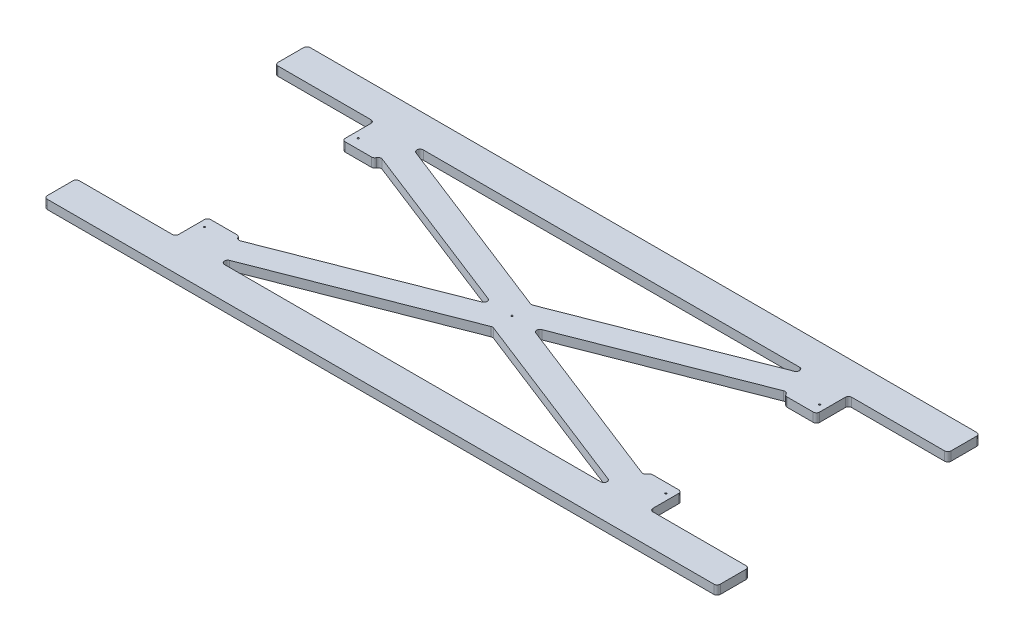
from build123d import *

# Parameters (mm, degrees)
SKETCH1_W                    = 1333.5
SKETCH1_H                    = 520.7
BOSS_EXTRUDE1_DEPTH          = 17.78
FILLET1_R                    = 6.35
F_1_8_0_125_DIAMETER_HOLE1_D = 3.175
SKETCH5_W                    = 152.4
SKETCH5_H                    = 393.7
CUT_EXTRUDE1_DEPTH           = 716.998473043
FILLET2_R                    = 6.35
SKETCH6_W                    = 50.8
SKETCH6_H                    = 393.7
SKETCH6_W_2                  = 63.5
SKETCH6_H_2                  = 266.7
CUT_EXTRUDE2_DEPTH           = 716.998473043
FILLET3_R                    = 6.35


with BuildPart() as part:
    # Sketch1 → Boss-Extrude1 (new body)
    with BuildSketch(Plane(origin=(0, 0, 0), x_dir=(1, 0, 0), z_dir=(0, 1, 0))):
        Rectangle(SKETCH1_W, SKETCH1_H)
    extrude(amount=BOSS_EXTRUDE1_DEPTH)

    # Fillet1
    fillet1_edges = [part.edges().sort_by_distance(p)[0] for p in [
        (-666.75, 8.89, 260.35),
        (-666.75, 8.89, -260.35),
        (666.75, 8.89, -260.35),
        (666.75, 8.89, 260.35),
    ]]
    fillet(fillet1_edges, radius=FILLET1_R)

    # 1/8 (0.125) Diameter Hole1 (through all)
    with Locations(Plane(origin=(0, 17.78, 0), x_dir=(1, 0, 0), z_dir=(0, 1, 0))):
        with Locations((0, 0), (457.2, 152.4), (-457.2, -152.4), (-457.2, 152.4), (457.2, -152.4)):
            Hole(F_1_8_0_125_DIAMETER_HOLE1_D / 2)

    # Sketch5 → Cut-Extrude1 (cut, through all)
    with BuildSketch(Plane(origin=(0, 17.78, 0), x_dir=(1, 0, 0), z_dir=(0, 1, 0))):
        Polygon((-406.4, 196.85), (406.4, 196.85), (0, 38.1), align=None)
        Polygon((0, -38.1), (-406.4, -196.85), (406.4, -196.85), align=None)
        Polygon((406.4, 143.8671875), (406.4, -143.8671875), (38.1, 0), align=None)
        Polygon((-406.4, 143.8671875), (-38.1, 0), (-406.4, -143.8671875), align=None)
        with Locations((546.1, 0)):
            Rectangle(SKETCH5_W, SKETCH5_H)
        with Locations((-546.1, 0)):
            Rectangle(SKETCH5_W, SKETCH5_H)
    extrude(amount=-CUT_EXTRUDE1_DEPTH, mode=Mode.SUBTRACT)

    # Fillet2
    fillet2_edges = [part.edges().sort_by_distance(p)[0] for p in [
        (469.9, 8.89, -196.85),
        (469.9, 8.89, 196.85),
        (622.3, 8.89, 196.85),
        (406.4, 8.89, 143.8671875),
        (406.4, 8.89, 196.85),
        (622.3, 8.89, -196.85),
        (406.4, 8.89, -143.8671875),
        (406.4, 8.89, -196.85),
        (38.1, 8.89, 0),
        (0, 8.89, 38.1),
        (0, 8.89, -38.1),
        (-38.1, 8.89, 0),
        (-406.4, 8.89, 196.85),
        (-406.4, 8.89, -196.85),
        (-406.4, 8.89, -143.8671875),
        (-406.4, 8.89, 143.8671875),
        (-622.3, 8.89, 196.85),
        (-469.9, 8.89, 196.85),
        (-469.9, 8.89, -196.85),
        (-622.3, 8.89, -196.85),
    ]]
    fillet(fillet2_edges, radius=FILLET2_R)

    # Sketch6 → Cut-Extrude2 (cut, through all)
    with BuildSketch(Plane(origin=(0, 17.78, 0), x_dir=(1, 0, 0), z_dir=(0, 1, 0))):
        with Locations((641.35, 0)):
            Rectangle(SKETCH6_W, SKETCH6_H)
        with Locations((-641.35, 0)):
            Rectangle(SKETCH6_W, SKETCH6_H)
        with Locations((-438.15, 0)):
            Rectangle(SKETCH6_W_2, SKETCH6_H_2)
        with Locations((438.15, 0)):
            Rectangle(SKETCH6_W_2, SKETCH6_H_2)
    extrude(amount=-CUT_EXTRUDE2_DEPTH, mode=Mode.SUBTRACT)

    # Fillet3
    fillet3_edges = [part.edges().sort_by_distance(p)[0] for p in [
        (-666.75, 8.89, 196.85),
        (-666.75, 8.89, -196.85),
        (666.75, 8.89, -196.85),
        (666.75, 8.89, 196.85),
        (-406.4, 8.89, 133.35),
        (-406.4, 8.89, -133.35),
        (-469.9, 8.89, 133.35),
        (-469.9, 8.89, -133.35),
        (469.9, 8.89, -133.35),
        (406.4, 8.89, -133.35),
        (469.9, 8.89, 133.35),
        (406.4, 8.89, 133.35),
    ]]
    fillet(fillet3_edges, radius=FILLET3_R)


solid = part.part
